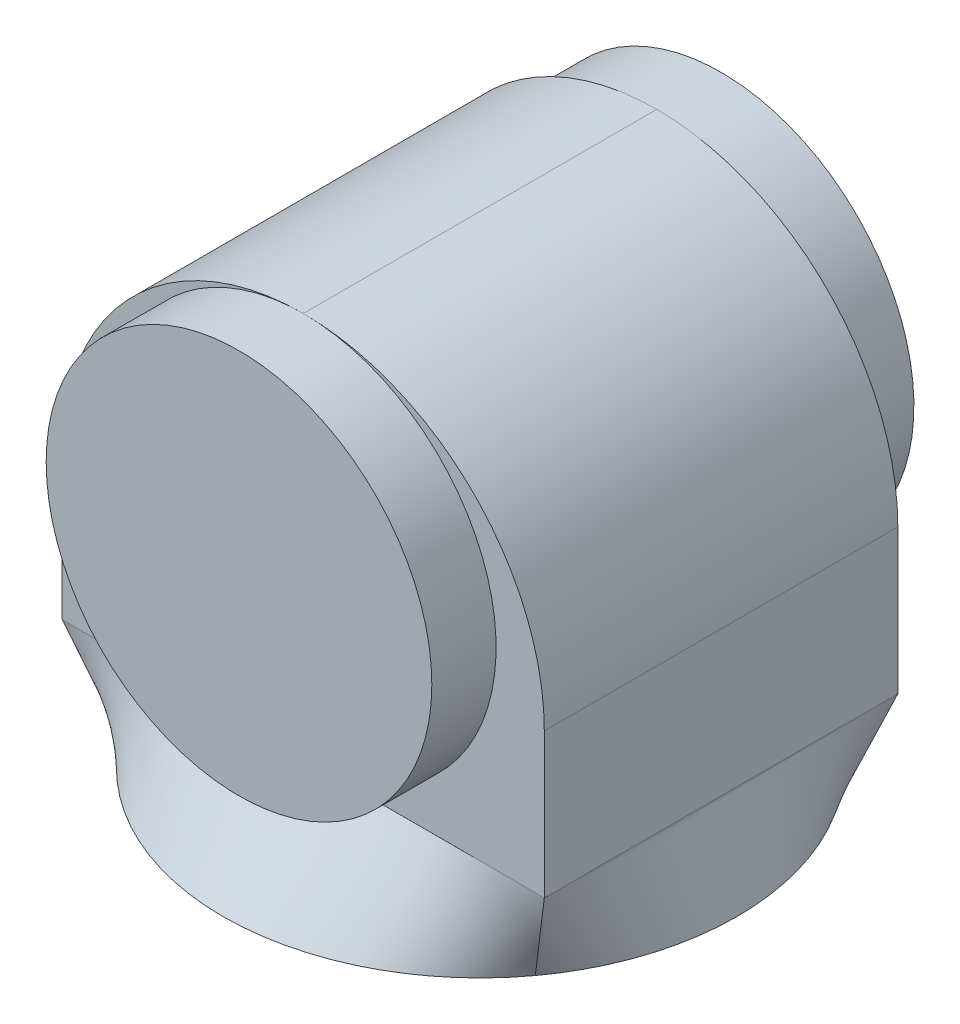
from build123d import *

# Parameters (mm, degrees)
SKIZZE4_W                       = 150
SKIZZE4_H                       = 110
AUFSATZ_LINEAR_AUSTRAGEN1_DEPTH = 120
SKIZZE5_R                       = 60
AUFSATZ_LINEAR_AUSTRAGEN2_DEPTH = 20
VERRUNDUNG1_R                   = 75


with BuildPart() as part:
    # Skizze1 for Ausformung1 → Ausformung1 section 0
    with BuildSketch(Plane(origin=(0, 0, 0), x_dir=(1, 0, 0), z_dir=(0, 1, 0))):
        with BuildLine():
            # circular arc as an exact rational Bezier (weights 1, cos(half-angle), 1)
            Bezier((-64.512399668, -47.30909309), (0, -135.280547185), (64.512399668, -47.30909309), weights=[1, 0.591363664, 1])
            Bezier((64.512399668, -47.30909309), (99.205734602, 0), (64.512399668, 47.30909309), weights=[1, 0.806404996, 1])
            Bezier((64.512399668, 47.30909309), (0, 135.280547185), (-64.512399668, 47.30909309), weights=[1, 0.591363664, 1])
            Bezier((-64.512399668, 47.30909309), (-99.205734602, 0), (-64.512399668, -47.30909309), weights=[1, 0.806404996, 1])
        make_face()
    # Skizze2 → Ausformung1 section 1
    with BuildSketch(Plane(origin=(0, 30, 0), x_dir=(1, 0, 0), z_dir=(0, 1, 0))):
        with BuildLine():
            Line((-75, -55), (75, -55))
            Line((75, -55), (75, 55))
            Line((75, 55), (-75, 55))
            Line((-75, 55), (-75, -55))
        make_face()
    loft()

    # Skizze4 → Aufsatz-Linear austragen1 (add)
    with BuildSketch(Plane(origin=(0, 30, 0), x_dir=(1, 0, 0), z_dir=(0, 1, 0))):
        Rectangle(SKIZZE4_W, SKIZZE4_H)
    extrude(amount=AUFSATZ_LINEAR_AUSTRAGEN1_DEPTH)

    # Skizze5 → Aufsatz-Linear austragen2 (add)
    with BuildSketch(Plane(origin=(-20, 0, 55), x_dir=(-1, 0, 0), z_dir=(0, 0, -1))):
        with Locations((-20, 90)):
            Circle(SKIZZE5_R)
    aufsatz_linear_austragen2 = extrude(amount=-AUFSATZ_LINEAR_AUSTRAGEN2_DEPTH)

    # Spiegeln1: Aufsatz-Linear austragen2 across plane
    add(aufsatz_linear_austragen2.mirror(Plane.XY))

    # Verrundung1
    # the kernel refuses this fillet: 75 mm, written as the material it takes off along each edge
    with BuildSketch(Plane(origin=(75, 150, 242.5), x_dir=(0, -1, 0), z_dir=(0, 0, -1))) as verrundung1_piece_1:
        with BuildLine():
            CenterArc((VERRUNDUNG1_R, VERRUNDUNG1_R), VERRUNDUNG1_R, 180, 90)
            Line((0, VERRUNDUNG1_R), (0, 0))
            Line((0, 0), (VERRUNDUNG1_R, 0))
        make_face()
    extrude(amount=485, mode=Mode.SUBTRACT)
    with BuildSketch(Plane(origin=(-75, 150, -242.5), x_dir=(1, 0, 0), z_dir=(0, 0, 1))) as verrundung1_piece_2:
        with BuildLine():
            CenterArc((VERRUNDUNG1_R, -VERRUNDUNG1_R), VERRUNDUNG1_R, 90, 90)
            Line((0, -VERRUNDUNG1_R), (0, 0))
            Line((0, 0), (VERRUNDUNG1_R, 0))
        make_face()
    extrude(amount=485, mode=Mode.SUBTRACT)


solid = part.part
